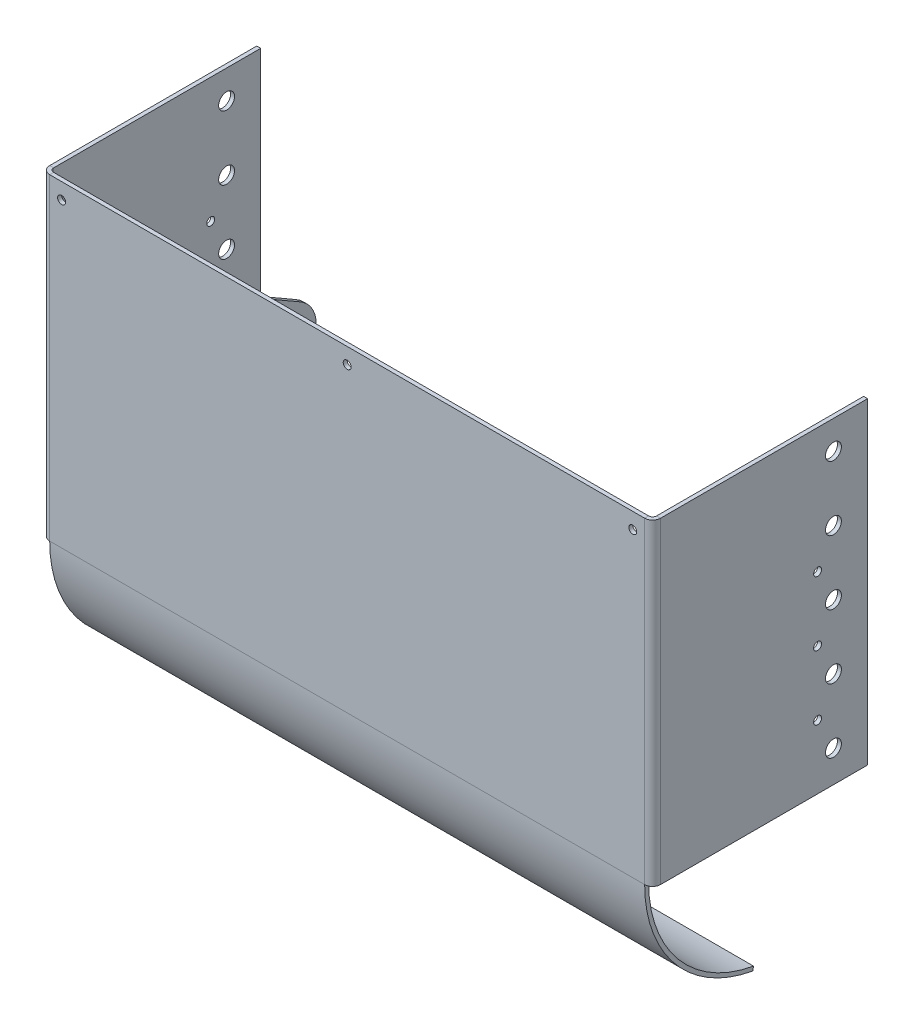
from build123d import *

# Parameters (mm, degrees)
BOSS_EXTRUDE2_DEPTH    = 127
CONVERT_SOLID1_START   = -127
CONVERT_SOLID1_DEPTH   = 254
CONVERT_SOLID1_2_DEPTH = 254
SKETCH7_R              = 6.35
SKETCH7_R_2            = 3.175
CUT_EXTRUDE1_DEPTH     = 513.718362651
SKETCH8_R              = 3.175
CUT_EXTRUDE2_DEPTH     = 25.4
BOSS_EXTRUDE3_DEPTH    = 3.175
SKETCH10_R             = 6.35
SKETCH10_R_2           = 1.25
CUT_EXTRUDE3_DEPTH     = 3.175
HEM1_START             = -238.125
HEM1_DEPTH             = 476.25


# Read off the part's stored shape, not the designer's step: Convert-Solid1, Hem1
with BuildPart() as part:
    # Sketch1 → Boss-Extrude2 (new, symmetric)
    with BuildSketch(Plane(origin=(0, 0, 0), x_dir=(1, 0, 0), z_dir=(0, 1, 0))):
        Polygon((-244.475, 84.455), (-241.3, 84.455), (-241.3, -84.455), (241.3, -84.455), (241.3, 84.455), (244.475, 87.63), (244.475, -87.63), (-244.475, -87.63), align=None)
    extrude(amount=BOSS_EXTRUDE2_DEPTH, both=True)

    # Convert-Solid1 outline → Convert-Solid1 (cut)
    with BuildSketch(Plane(origin=(0, 0, 0), x_dir=(1, 0, 0), z_dir=(0, 1, 0)).offset(CONVERT_SOLID1_START)):
        Polygon((244.475, 87.63), (241.3, 84.455), (244.475, 84.455), align=None)
        with BuildLine():
            Line((-244.475, -87.63), (-238.125, -87.63))
            ThreePointArc((-238.125, -87.63), (-242.615128061, -85.770128061), (-244.475, -81.28))
            Line((-244.475, -81.28), (-244.475, -87.63))
        make_face()
        with BuildLine():
            Line((244.475, -87.63), (244.475, -81.28))
            ThreePointArc((244.475, -81.28), (242.615128061, -85.770128061), (238.125, -87.63))
            Line((238.125, -87.63), (244.475, -87.63))
        make_face()
    extrude(amount=CONVERT_SOLID1_DEPTH, mode=Mode.SUBTRACT)

    # Convert-Solid1 2 outline → Convert-Solid1 2 (add)
    with BuildSketch(Plane(origin=(0, 0, 0), x_dir=(1, 0, 0), z_dir=(0, 1, 0)).offset(CONVERT_SOLID1_START)):
        with BuildLine():
            Line((-241.3, -84.455), (-238.125, -84.455))
            ThreePointArc((-238.125, -84.455), (-240.37006403, -83.52506403), (-241.3, -81.28))
            Line((-241.3, -81.28), (-241.3, -84.455))
        make_face()
        with BuildLine():
            Line((241.3, -84.455), (241.3, -81.28))
            ThreePointArc((241.3, -81.28), (240.37006403, -83.52506403), (238.125, -84.455))
            Line((238.125, -84.455), (241.3, -84.455))
        make_face()
    extrude(amount=CONVERT_SOLID1_2_DEPTH)

    # Sketch7 → Cut-Extrude1 (cut, through all)
    with BuildSketch(Plane.ZY.offset(244.475)):
        with Locations((-57.15, 155.575)):
            Circle(SKETCH7_R)
        with Locations((-57.15, 104.14)):
            Circle(SKETCH7_R)
        with Locations((-57.15, 52.705)):
            Circle(SKETCH7_R)
        with Locations((-57.15, 1.27)):
            Circle(SKETCH7_R)
        with Locations((-57.15, -50.165)):
            Circle(SKETCH7_R)
        with Locations((-57.15, 207.01)):
            Circle(SKETCH7_R)
        with Locations((-57.15, -101.6)):
            Circle(SKETCH7_R)
        with Locations((-44.45, -24.4475)):
            Circle(SKETCH7_R_2)
        with Locations((-44.45, 26.9875)):
            Circle(SKETCH7_R_2)
        with Locations((-44.45, -75.8825)):
            Circle(SKETCH7_R_2)
    extrude(amount=-CUT_EXTRUDE1_DEPTH, mode=Mode.SUBTRACT)

    # Sketch8 → Cut-Extrude2 (cut)
    with BuildSketch(Plane.XY.offset(87.63)):
        with Locations((0, 114.3)):
            Circle(SKETCH8_R)
        with Locations((228.6, 114.3)):
            Circle(SKETCH8_R)
        with Locations((-228.6, 114.3)):
            Circle(SKETCH8_R)
    extrude(amount=-CUT_EXTRUDE2_DEPTH, mode=Mode.SUBTRACT)

    # Sketch9 → Boss-Extrude3 (add)
    with BuildSketch(Plane.ZY.offset(244.475)):
        with BuildLine():
            Line((-84.455, -46.344167394), (-116.205, -64.675038441))
            ThreePointArc((-116.205, -64.675038441), (-128.905, -86.672083697), (-116.205, -108.669128953))
            Line((-116.205, -108.669128953), (-84.455, -127))
            Line((-84.455, -127), (-84.455, -46.344167394))
        make_face()
    extrude(amount=-BOSS_EXTRUDE3_DEPTH)

    # Sketch10 → Cut-Extrude3 (cut)
    with BuildSketch(Plane.ZY.offset(244.475)):
        with Locations((-96.505, -86.672083697)):
            Circle(SKETCH10_R)
        with Locations((-90.081606241, -94.422083697)):
            Circle(SKETCH10_R_2)
        with Locations((-116.928393759, -94.422083697)):
            Circle(SKETCH10_R_2)
        with Locations((-116.928393759, -78.922083697)):
            Circle(SKETCH10_R_2)
        with Locations((-90.081606241, -78.922083697)):
            Circle(SKETCH10_R_2)
    extrude(amount=-CUT_EXTRUDE3_DEPTH, mode=Mode.SUBTRACT)

    # Hem1 outline → Hem1 (add)
    with BuildSketch(Plane.YZ.offset(HEM1_START)):
        with BuildLine():
            Line((-230.183232322, 1.048987815), (-227.056467706, 0.497654851))
            ThreePointArc((-227.056467706, 0.497654851), (-192.307221144, 60.685115421), (-127, 84.455))
            Line((-127, 84.455), (-127, 87.63))
            ThreePointArc((-127, 87.63), (-194.348071805, 63.117306528), (-230.183232322, 1.048987815))
        make_face()
    extrude(amount=HEM1_DEPTH)


solid = part.part
